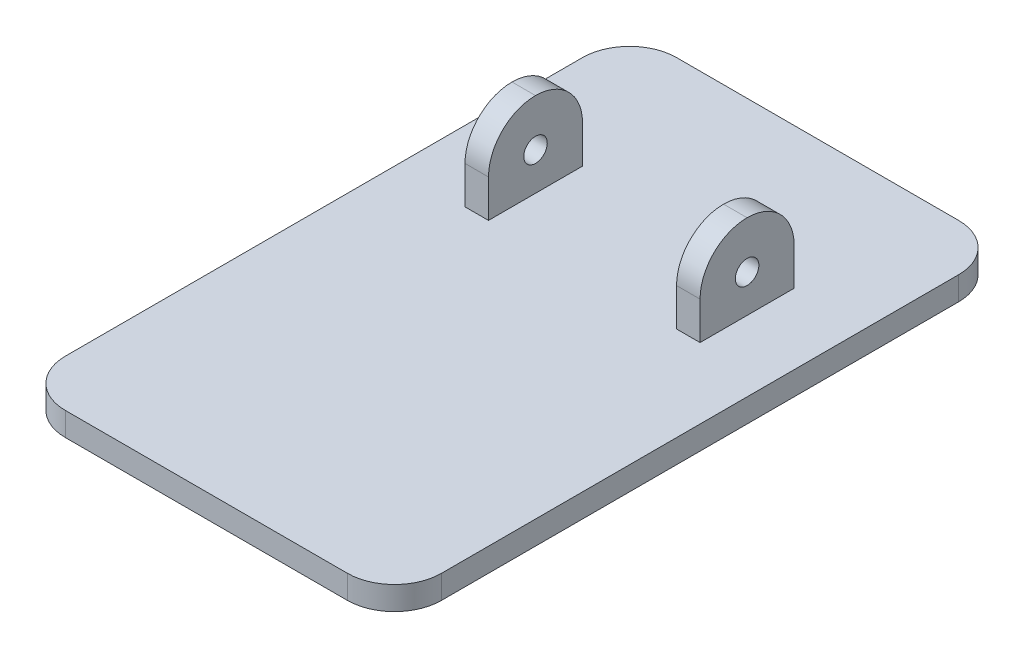
from build123d import *

# Parameters (mm, degrees)
SZKIC1_W                    = 80
SZKIC1_H                    = 130
DODANIE_WYCI_GNI_CIE1_DEPTH = 5
ZAOKR_GLENIE1_R             = 10
SZKIC2_W                    = 5
SZKIC2_H                    = 20
DODANIE_WYCI_GNI_CIE2_DEPTH = 18
ZAOKR_GLENIE2_R             = 10
SZKIC3_R                    = 2.5
WYTNIJ_WYCI_GNI_CIE1_DEPTH  = 100


with BuildPart() as part:
    # Szkic1 → Dodanie-wyciągnięcie1 (new body)
    with BuildSketch(Plane(origin=(0, 0, 0), x_dir=(1, 0, 0), z_dir=(0, 1, 0))):
        Rectangle(SZKIC1_W, SZKIC1_H)
    extrude(amount=DODANIE_WYCI_GNI_CIE1_DEPTH)

    # Zaokrąglenie1
    zaokr_glenie1_edges = [part.edges().sort_by_distance(p)[0] for p in [
        (40, 2.5, -65),
        (40, 2.5, 65),
        (-40, 2.5, 65),
        (-40, 2.5, -65),
    ]]
    fillet(zaokr_glenie1_edges, radius=ZAOKR_GLENIE1_R)

    # Szkic2 → Dodanie-wyciągnięcie2 (add)
    with BuildSketch(Plane(origin=(0, 5, 0), x_dir=(1, 0, 0), z_dir=(0, 1, 0))):
        with Locations((-22.5, 25)):
            Rectangle(SZKIC2_W, SZKIC2_H)
        with Locations((22.5, 25)):
            Rectangle(SZKIC2_W, SZKIC2_H)
    extrude(amount=DODANIE_WYCI_GNI_CIE2_DEPTH)

    # Zaokrąglenie2
    zaokr_glenie2_edges = [part.edges().sort_by_distance(p)[0] for p in [
        (22.5, 23, -15),
        (22.5, 23, -35),
        (-22.5, 23, -15),
        (-22.5, 23, -35),
    ]]
    fillet(zaokr_glenie2_edges, radius=ZAOKR_GLENIE2_R - 0.0001)  # a hair under: the kernel refuses the full size

    # Szkic3 → Wytnij-wyciągnięcie1 (cut)
    with BuildSketch(Plane.ZY.offset(25)):
        with Locations((-25, 13)):
            Circle(SZKIC3_R)
    extrude(amount=-WYTNIJ_WYCI_GNI_CIE1_DEPTH, mode=Mode.SUBTRACT)


solid = part.part
